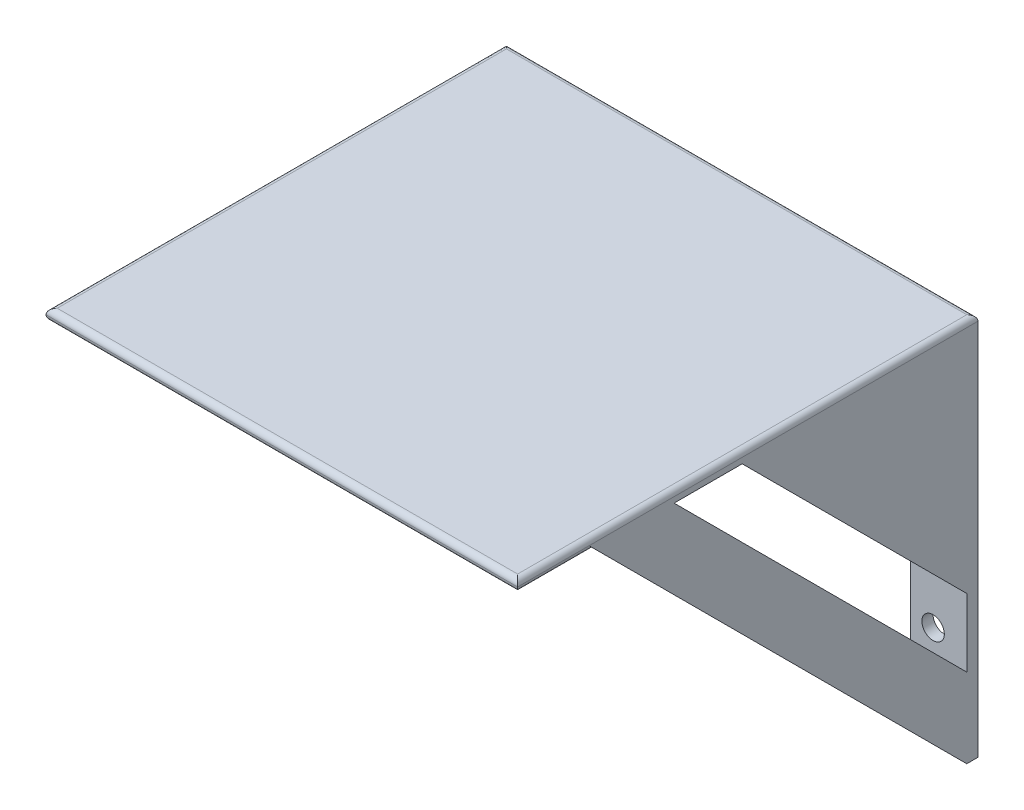
from build123d import *

# Parameters (mm, degrees)
BOSS_EXTRUDE1_DEPTH = 3.175
SKETCH3_R           = 3.175
CUT_EXTRUDE1_DEPTH  = 86.976283948
SKETCH4_W           = 133.35
SKETCH4_H           = 3.175
BOSS_EXTRUDE2_DEPTH = 127
BOSS_EXTRUDE3_DEPTH = 3.175
BOSS_EXTRUDE4_DEPTH = 3.175
FILLET2_R           = 1.5875


with BuildPart() as part:
    # Sketch2 → Boss-Extrude1 (new body)
    with BuildSketch(Plane.XY):
        Polygon((-50.8, -54.187499956), (-50.8, 12.912499956), (-25.4, 38.312499956), (25.4, 38.312499956), (50.8, 12.912499956), (50.8, -54.187499956), (66.675, -54.187499956), (66.675, 54.187499956), (-66.675, 54.187499956), (-66.675, -54.187499956), align=None)
    extrude(amount=BOSS_EXTRUDE1_DEPTH)

    # Sketch3 → Cut-Extrude1 (cut, through all)
    with BuildSketch(Plane.XY.offset(3.175)):
        with Locations((-57.15, -25.612499956)):
            Circle(SKETCH3_R)
        with Locations((-57.15, 22.437499956)):
            Circle(SKETCH3_R)
        with Locations((-34.925, 44.662499956)):
            Circle(SKETCH3_R)
        with Locations(Location((34.925, 44.662499956, 0), (0, 0, 180))):
            Circle(SKETCH3_R)
        with Locations(Location((57.15, 22.437499956, 0), (0, 0, 180))):
            Circle(SKETCH3_R)
        with Locations(Location((57.15, -25.612499956, 0), (0, 0, 180))):
            Circle(SKETCH3_R)
    extrude(amount=-CUT_EXTRUDE1_DEPTH, mode=Mode.SUBTRACT)

    # Sketch4 → Boss-Extrude2 (add)
    with BuildSketch(Plane.XY.offset(3.175)):
        with Locations((0, 52.599999956)):
            Rectangle(SKETCH4_W, SKETCH4_H)
    extrude(amount=BOSS_EXTRUDE2_DEPTH)

    # Sketch5 → Boss-Extrude3 (add)
    with BuildSketch(Plane.ZY.offset(66.675)):
        Polygon((3.175, -12.487500044), (66.675, 51.012499956), (3.175, 51.012499956), align=None)
        Polygon((108.374999912, 51.012499956), (3.175, -54.187499956), (3.175, -31.736859653), (85.924359609, 51.012499956), align=None)
    extrude(amount=-BOSS_EXTRUDE3_DEPTH)

    # Sketch6 → Boss-Extrude4 (add)
    with BuildSketch(Plane(origin=(66.675, 0, 0), x_dir=(0, 0, -1), z_dir=(1, 0, 0))):
        Polygon((-108.374999912, 51.012499956), (-3.175, -54.187499956), (-3.175, -31.736859653), (-85.924359609, 51.012499956), align=None)
        Polygon((-3.175, -12.487500044), (-66.675, 51.012499956), (-3.175, 51.012499956), align=None)
    extrude(amount=-BOSS_EXTRUDE4_DEPTH)

    # Fillet2
    fillet2_edges = [part.edges().sort_by_distance(p)[0] for p in [
        (66.675, 54.187499956, 65.0875),
        (0, 54.187499956, 130.175),
        (-66.675, 54.187499956, 65.0875),
        (0, 54.187499956, 0),
        (66.675, 51.012499956, 119.274999956),
        (0, 51.012499956, 130.175),
        (-66.675, 51.012499956, 119.274999956),
    ]]
    fillet(fillet2_edges, radius=FILLET2_R - 0.0001)  # a hair under: the kernel refuses the full size


solid = part.part
